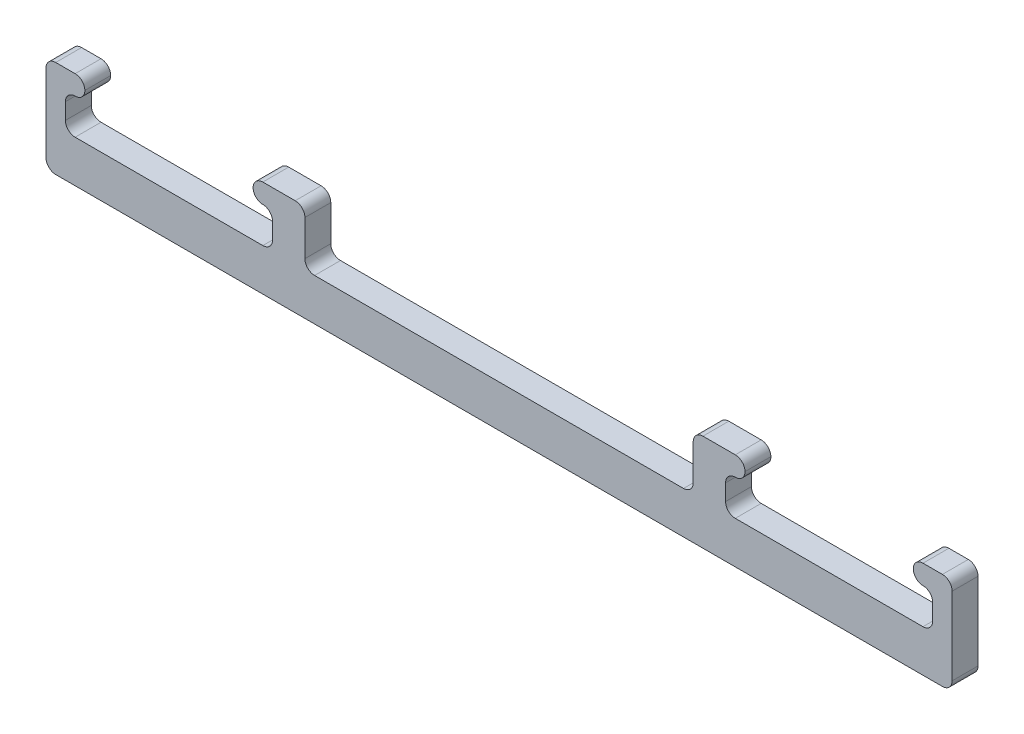
from build123d import *

# Parameters (mm, degrees)
ESQUISSE1_W             = 140
ESQUISSE1_H             = 15
BOSS_EXTRU_1_DEPTH      = 4
ENL_V_MAT_EXTRU_1_DEPTH = 10
ESQUISSE3_W             = 60
ESQUISSE3_H             = 8.5
ENL_V_MAT_EXTRU_2_DEPTH = 10
CONG_1_R                = 1.5


with BuildPart() as part:
    # Esquisse1 → Boss.-Extru.1 (new body)
    with BuildSketch(Plane.XY):
        with Locations((0, 7.5)):
            Rectangle(ESQUISSE1_W, ESQUISSE1_H)
    extrude(amount=BOSS_EXTRU_1_DEPTH)

    # Esquisse2 → Enlèv. mat.-Extru.1 (cut)
    with BuildSketch(Plane.XY.offset(4)):
        Polygon((-64, 15), (-64, 12), (-67, 12), (-67, 6.5), (-35, 6.5), (-35, 12), (-38, 12), (-38, 15), align=None)
        Polygon((38, 12), (38, 15), (64, 15), (64, 12), (67, 12), (67, 6.5), (35, 6.5), (35, 12), align=None)
    extrude(amount=-ENL_V_MAT_EXTRU_1_DEPTH, mode=Mode.SUBTRACT)

    # Esquisse3 → Enlèv. mat.-Extru.2 (cut)
    with BuildSketch(Plane.XY.offset(4)):
        with Locations((0, 10.75)):
            Rectangle(ESQUISSE3_W, ESQUISSE3_H)
    extrude(amount=-ENL_V_MAT_EXTRU_2_DEPTH, mode=Mode.SUBTRACT)

    # Congé1
    cong_1_edges = [part.edges().sort_by_distance(p)[0] for p in [
        (30, 15, 2),
        (38, 15, 2),
        (64, 15, 2),
        (70, 15, 2),
        (-70, 0, 2),
        (-70, 15, 2),
        (-64, 15, 2),
        (-64, 12, 2),
        (-67, 12, 2),
        (-67, 6.5, 2),
        (-35, 6.5, 2),
        (-35, 12, 2),
        (-38, 12, 2),
        (-38, 15, 2),
        (-30, 15, 2),
        (-30, 6.5, 2),
        (30, 6.5, 2),
        (35, 6.5, 2),
        (67, 6.5, 2),
        (70, 0, 2),
        (64, 12, 2),
        (67, 12, 2),
        (35, 12, 2),
        (38, 12, 2),
    ]]
    fillet(cong_1_edges, radius=CONG_1_R - 0.0001)  # a hair under: the kernel refuses the full size


solid = part.part
